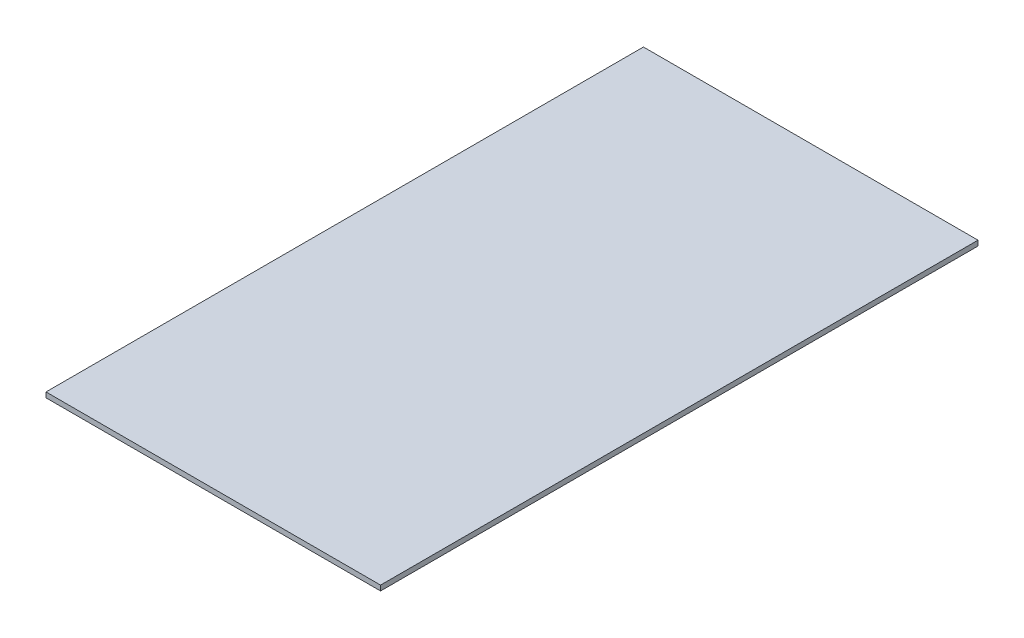
from build123d import *

# Parameters (mm, degrees)
SKETCH1_W           = 196
SKETCH1_H           = 350
BOSS_EXTRUDE1_DEPTH = 3


with BuildPart() as part:
    # Sketch1 → Boss-Extrude1 (new body)
    with BuildSketch(Plane(origin=(0, 0, 0), x_dir=(1, 0, 0), z_dir=(0, 1, 0))):
        with Locations((98, 175)):
            Rectangle(SKETCH1_W, SKETCH1_H)
    extrude(amount=BOSS_EXTRUDE1_DEPTH)


solid = part.part
